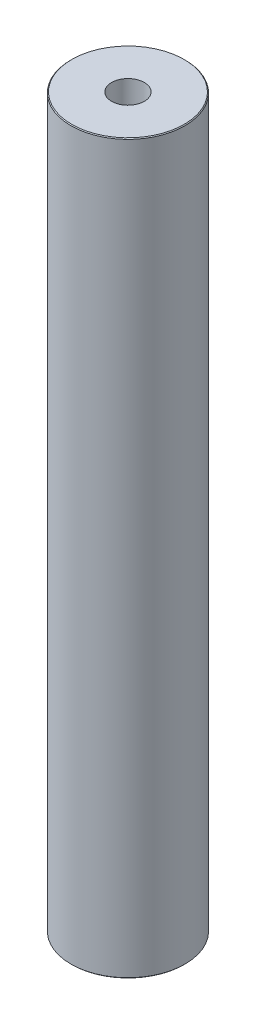
from build123d import *

# Parameters (mm, degrees)
SKETCH1_R           = 42.5
BOSS_EXTRUDE1_DEPTH = 542.325363733
SKETCH2_R           = 12.200683815
CUT_EXTRUDE1_DEPTH  = 546.645764346
CHAMFER1_SIZE       = 0.591874324


with BuildPart() as part:
    # Sketch1 → Boss-Extrude1 (new body)
    with BuildSketch(Plane(origin=(0, 0, 0), x_dir=(1, 0, 0), z_dir=(0, 1, 0))):
        Circle(SKETCH1_R)
    extrude(amount=BOSS_EXTRUDE1_DEPTH)

    # Sketch2 → Cut-Extrude1 (cut, through all)
    with BuildSketch(Plane(origin=(0, 0, 0), x_dir=(1, 0, 0), z_dir=(0, 1, 0))):
        Circle(SKETCH2_R)
    extrude(amount=CUT_EXTRUDE1_DEPTH, mode=Mode.SUBTRACT)

    # Chamfer1
    chamfer1_edges = [part.edges().sort_by_distance(p)[0] for p in [
        (-42.5, 542.325363733, 0),
        (-42.5, 0, 0),
    ]]
    chamfer(chamfer1_edges, length=CHAMFER1_SIZE)


solid = part.part
